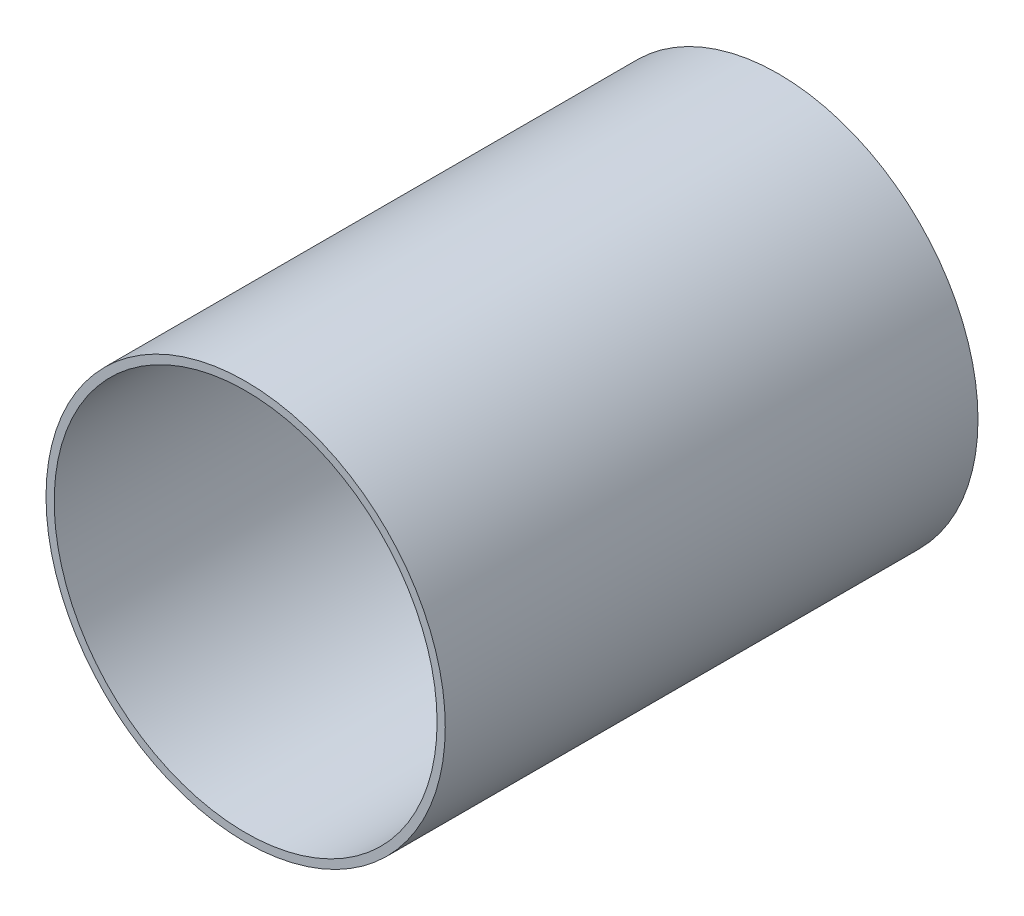
from build123d import *

# Parameters (mm, degrees)
SKETCH1_R           = 38.0746
SKETCH1_R_2         = 36.5125
BOSS_EXTRUDE1_DEPTH = 50.8


with BuildPart() as part:
    # Sketch1 → Boss-Extrude1 (new, symmetric)
    with BuildSketch(Plane.XY):
        Circle(SKETCH1_R)
        Circle(SKETCH1_R_2, mode=Mode.SUBTRACT)
    extrude(amount=BOSS_EXTRUDE1_DEPTH, both=True)


solid = part.part
